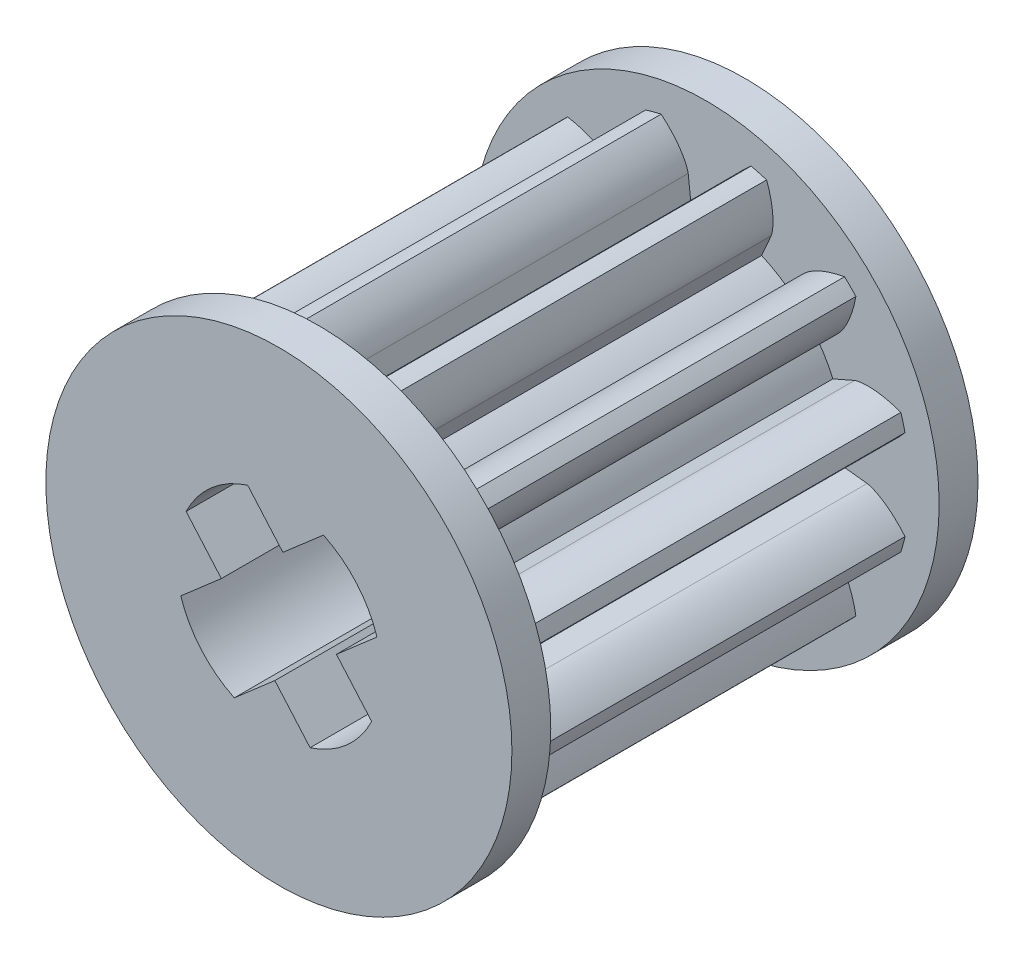
from build123d import *

# Parameters (mm, degrees)
SKETCH1_R               = 5.25
BOSS_EXTRUDE1_DEPTH     = 10
CUT_EXTRUDE3_DEPTH      = 13.454918707
CIRPATTERN1_COUNT       = 12
SKETCH6_R               = 6
BOSS_EXTRUDE2_DEPTH     = 1
CUT_EXTRUDE4_DEPTH      = 14.892444076
CUT_EXTRUDE4_DEPTH_BACK = 14.892444076


with BuildPart() as part:
    # Sketch1 → Boss-Extrude1 (new body)
    with BuildSketch(Plane.XY):
        Circle(SKETCH1_R)
    extrude(amount=BOSS_EXTRUDE1_DEPTH)

    # Sketch3 → Cut-Extrude3 (cut, through all)
    with BuildSketch(Plane.XY):
        with BuildLine():
            add(Edge.make_bspline(
                [(0.461546791, 4.146720396), (0.463953922, 4.163714882), (0.472985914, 4.201315534), (0.494149183, 4.266634462), (0.528558847, 4.349970943), (0.562413319, 4.416839281), (0.584280793, 4.45603904), (0.587367865, 4.461501876)],
                knots=[0, 0, 0, 0, 0.040008387, 0.090017613, 0.160030412, 0.250046806, 0.264674884, 0.264674884, 0.264674884, 0.264674884], degree=3))
            add(Edge.make_bspline(
                [(0.587367865, 4.461501876), (0.634900369, 4.545614692), (0.726044104, 4.679105945), (0.914750766, 4.902091874), (1.057206539, 5.036685302), (1.15776547, 5.120749859)],
                knots=[0.264674884, 0.264674884, 0.264674884, 0.264674884, 0.489907489, 0.63993471, 0.945583804, 0.945583804, 0.945583804, 0.945583804], degree=3))
            ThreePointArc((1.15776547, 5.120749859), (0, 5.25), (-1.15776547, 5.120749859))
            add(Edge.make_bspline(
                [(-0.587367865, 4.461501876), (-0.634900369, 4.545614692), (-0.726044104, 4.679105945), (-0.914750766, 4.902091874), (-1.057206539, 5.036685302), (-1.15776547, 5.120749859)],
                knots=[0.264674884, 0.264674884, 0.264674884, 0.264674884, 0.489907489, 0.63993471, 0.945583804, 0.945583804, 0.945583804, 0.945583804], degree=3))
            add(Edge.make_bspline(
                [(-0.461546791, 4.146720396), (-0.463953922, 4.163714882), (-0.472985914, 4.201315534), (-0.494149183, 4.266634462), (-0.528558847, 4.349970943), (-0.562413319, 4.416839281), (-0.584280793, 4.45603904), (-0.587367865, 4.461501876)],
                knots=[0, 0, 0, 0, 0.040008387, 0.090017613, 0.160030412, 0.250046806, 0.264674884, 0.264674884, 0.264674884, 0.264674884], degree=3))
            Line((-0.461546791, 4.146720396), (-0.394087114, 3.540635762))
            ThreePointArc((-0.394087114, 3.540635762), (0, 3.5625), (0.394087114, 3.540635762))
            Line((0.394087114, 3.540635762), (0.461546791, 4.146720396))
        make_face()
    cut_extrude3 = extrude(amount=CUT_EXTRUDE3_DEPTH, mode=Mode.SUBTRACT)

    # CirPattern1: Cut-Extrude3 ×12 about axis
    cirpattern1_axis = Axis((0, 0, 71.213492813), (0, 0, -1))
    for i in range(1, CIRPATTERN1_COUNT):
        add(cut_extrude3.rotate(cirpattern1_axis, i * 360 / CIRPATTERN1_COUNT), mode=Mode.SUBTRACT)

    # Sketch6 → Boss-Extrude2 (add)
    with BuildSketch(Plane.XY.offset(10)):
        Circle(SKETCH6_R)
    boss_extrude2 = extrude(amount=BOSS_EXTRUDE2_DEPTH)

    # Mirror1: Boss-Extrude2 across plane
    add(boss_extrude2.mirror(Plane.XY.offset(5)))

    # Sketch5 → Cut-Extrude4 (cut, two sides: drawn at the far end of the back side and taken through both)
    with BuildSketch(Plane.XY.offset(-CUT_EXTRUDE4_DEPTH_BACK)):
        with BuildLine():
            Line((1.147891735, 2.388481644), (0.103872104, 1.481286801))
            Line((0.103872104, 1.481286801), (-0.80332274, 2.525306432))
            ThreePointArc((-0.80332274, 2.525306432), (-1.738166165, 2.00031957), (-2.388481644, 1.147891735))
            Line((-2.388481644, 1.147891735), (-1.481286801, 0.103872104))
            Line((-1.481286801, 0.103872104), (-2.525306432, -0.80332274))
            ThreePointArc((-2.525306432, -0.80332274), (-2.00031957, -1.738166165), (-1.147891735, -2.388481644))
            Line((-1.147891735, -2.388481644), (-0.103872104, -1.481286801))
            Line((-0.103872104, -1.481286801), (0.80332274, -2.525306432))
            ThreePointArc((0.80332274, -2.525306432), (1.738166165, -2.00031957), (2.388481644, -1.147891735))
            Line((2.388481644, -1.147891735), (1.481286801, -0.103872104))
            Line((1.481286801, -0.103872104), (2.525306432, 0.80332274))
            ThreePointArc((2.525306432, 0.80332274), (2.00031957, 1.738166165), (1.147891735, 2.388481644))
        make_face()
    extrude(amount=CUT_EXTRUDE4_DEPTH + CUT_EXTRUDE4_DEPTH_BACK, mode=Mode.SUBTRACT)


solid = part.part
